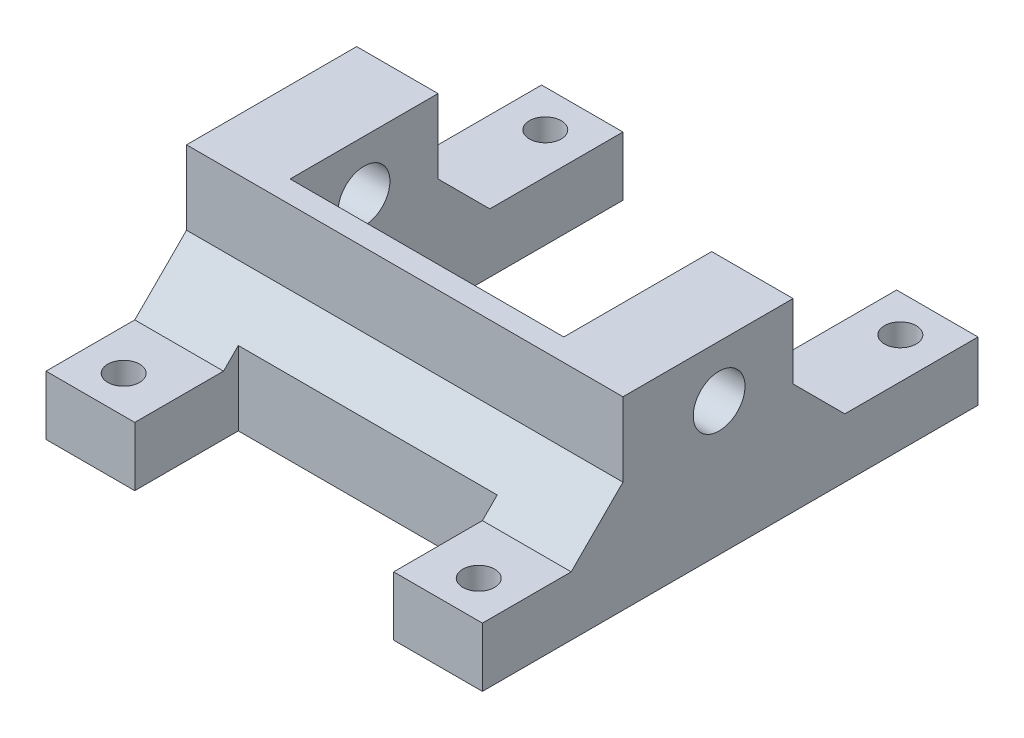
from build123d import *

# Parameters (mm, degrees)
SKETCH_1_R          = 3.5
EXTRUDE_1_DEPTH     = 29.5
SKETCH_3_W          = 37
SKETCH_3_H          = 17
CUT_EXTRUDE_2_DEPTH = 20
CUT_EXTRUDE_3_REACH = 60.849
SKETCH_4_W          = 37
SKETCH_4_H          = 45
SKETCH_4_W_2        = 35
SKETCH_4_H_2        = 14
HOLE_WIZARD_M4_1_D  = 4.3
CHAMFER_1_SIZE      = 7


with BuildPart() as part:
    # 草图1 → 凸台-拉伸1 (new, symmetric)
    with BuildSketch(Plane(origin=(0, 0, 0), x_dir=(0, 0, -1), z_dir=(1, 0, 0))):
        Polygon((0, 8), (0, 25), (23, 25), (23, 8), (48, 8), (48, 0), (-19, 0), (-19, 8), align=None)
        with Locations((13, 18)):
            Circle(SKETCH_1_R, mode=Mode.SUBTRACT)
    extrude(amount=EXTRUDE_1_DEPTH, both=True)

    # 草图3 → 切除-拉伸2 (cut)
    with BuildSketch(Plane(origin=(0, 0, -23), x_dir=(-1, 0, 0), z_dir=(0, 0, -1))):
        with Locations((0, 16.5)):
            Rectangle(SKETCH_3_W, SKETCH_3_H)
    extrude(amount=-CUT_EXTRUDE_2_DEPTH, mode=Mode.SUBTRACT)

    # 草图4 → 切除-拉伸3 (cut, up to next)
    with BuildSketch(Plane(origin=(0, 8, 0), x_dir=(1, 0, 0), z_dir=(0, 1, 0)), mode=Mode.PRIVATE) as cut_extrude_3_sk1:
        with Locations((0, 25.5)):
            Rectangle(SKETCH_4_W, SKETCH_4_H)
    cut_extrude_3_tool1 = extrude(cut_extrude_3_sk1.sketch, amount=-CUT_EXTRUDE_3_REACH, mode=Mode.PRIVATE) & part.part
    # 草图4 → 切除-拉伸3 (cut, up to next)
    with BuildSketch(Plane(origin=(0, 8, 0), x_dir=(1, 0, 0), z_dir=(0, 1, 0)), mode=Mode.PRIVATE) as cut_extrude_3_sk2:
        with Locations((0, -12)):
            Rectangle(SKETCH_4_W_2, SKETCH_4_H_2)
    cut_extrude_3_tool2 = extrude(cut_extrude_3_sk2.sketch, amount=-CUT_EXTRUDE_3_REACH, mode=Mode.PRIVATE) & part.part
    add(cut_extrude_3_tool1.solids().sort_by_distance((0, 8, -25.5))[0], mode=Mode.SUBTRACT)
    add(cut_extrude_3_tool2.solids().sort_by_distance((0, 8, 12))[0], mode=Mode.SUBTRACT)

    # M4 间隙孔1 (through all)
    with Locations(Plane(origin=(0, 0, 0), x_dir=(-1, 0, 0), z_dir=(0, -1, 0))):
        with Locations((24, -14), (24, 43), (-24, -14), (-24, 43)):
            Hole(HOLE_WIZARD_M4_1_D / 2)

    # 倒角1
    # the kernel refuses this chamfer: 7 mm, written as the material it adds along each edge
    with BuildSketch(Plane(origin=(-29.5, 8, 0), x_dir=(0, 0.9996219169112968, -0.027495876610586365), z_dir=(1, 0, 0))) as chamfer_1_piece_1_section:
        Polygon((CHAMFER_1_SIZE * 0.999621916911, CHAMFER_1_SIZE * 0.0274958766106), (-CHAMFER_1_SIZE * 0.0274958766106, CHAMFER_1_SIZE * 0.999621916911), (0, 0), align=None)
    chamfer_1_piece_1 = extrude(amount=59, mode=Mode.PRIVATE)
    chamfer_1_piece_1 = split(chamfer_1_piece_1, bisect_by=Plane(origin=(-17.5, 10.498239804, 1.946316209), z_dir=(-1, 0, 0)), keep=Keep.TOP, mode=Mode.PRIVATE)
    chamfer_1_piece_1 = split(chamfer_1_piece_1, bisect_by=Plane(origin=(-23.5, 10.498239804, 5), z_dir=(0, 0, -1)), keep=Keep.TOP, mode=Mode.PRIVATE)
    add(chamfer_1_piece_1)
    with BuildSketch(Plane(origin=(-29.5, 8, 0), x_dir=(0, 0.9996219169112968, -0.027495876610586365), z_dir=(1, 0, 0))) as chamfer_1_piece_2_section:
        Polygon((CHAMFER_1_SIZE * 0.999621916911, CHAMFER_1_SIZE * 0.0274958766106), (-CHAMFER_1_SIZE * 0.0274958766106, CHAMFER_1_SIZE * 0.999621916911), (0, 0), align=None)
    chamfer_1_piece_2 = extrude(amount=59, mode=Mode.PRIVATE)
    chamfer_1_piece_2 = split(chamfer_1_piece_2, bisect_by=Plane(origin=(-17.5, 8.493423537, 5.774901665), z_dir=(-1, 0, 0)), keep=Keep.TOP, mode=Mode.PRIVATE)
    chamfer_1_piece_2 = split(chamfer_1_piece_2, bisect_by=Plane(origin=(-23.5, 8.493423537, 5), z_dir=(0, 0, 1)), keep=Keep.TOP, mode=Mode.PRIVATE)
    add(chamfer_1_piece_2)
    with BuildSketch(Plane(origin=(-29.5, 8, 0), x_dir=(0, 0.9996219169112968, -0.027495876610586365), z_dir=(1, 0, 0))) as chamfer_1_piece_3_section:
        Polygon((CHAMFER_1_SIZE * 0.999621916911, CHAMFER_1_SIZE * 0.0274958766106), (-CHAMFER_1_SIZE * 0.0274958766106, CHAMFER_1_SIZE * 0.999621916911), (0, 0), align=None)
    chamfer_1_piece_3 = extrude(amount=59, mode=Mode.PRIVATE)
    chamfer_1_piece_3 = split(chamfer_1_piece_3, bisect_by=Plane(origin=(-17.5, 10.498239804, 1.946316209), z_dir=(1, 0, 0)), keep=Keep.TOP, mode=Mode.PRIVATE)
    chamfer_1_piece_3 = split(chamfer_1_piece_3, bisect_by=Plane(origin=(0, 10.498239804, 5), z_dir=(0, 0, -1)), keep=Keep.TOP, mode=Mode.PRIVATE)
    chamfer_1_piece_3 = split(chamfer_1_piece_3, bisect_by=Plane(origin=(17.5, 10.498239804, 1.946316209), z_dir=(-1, 0, 0)), keep=Keep.TOP, mode=Mode.PRIVATE)
    add(chamfer_1_piece_3)
    with BuildSketch(Plane(origin=(-29.5, 8, 0), x_dir=(0, 0.9996219169112968, -0.027495876610586365), z_dir=(1, 0, 0))) as chamfer_1_piece_4_section:
        Polygon((CHAMFER_1_SIZE * 0.999621916911, CHAMFER_1_SIZE * 0.0274958766106), (-CHAMFER_1_SIZE * 0.0274958766106, CHAMFER_1_SIZE * 0.999621916911), (0, 0), align=None)
    chamfer_1_piece_4 = extrude(amount=59, mode=Mode.PRIVATE)
    chamfer_1_piece_4 = split(chamfer_1_piece_4, bisect_by=Plane(origin=(23.5, 10.498239804, 5), z_dir=(0, 0, -1)), keep=Keep.TOP, mode=Mode.PRIVATE)
    chamfer_1_piece_4 = split(chamfer_1_piece_4, bisect_by=Plane(origin=(17.5, 10.498239804, 1.946316209), z_dir=(1, 0, 0)), keep=Keep.TOP, mode=Mode.PRIVATE)
    add(chamfer_1_piece_4)
    with BuildSketch(Plane(origin=(-29.5, 8, 0), x_dir=(0, 0.9996219169112968, -0.027495876610586365), z_dir=(1, 0, 0))) as chamfer_1_piece_5_section:
        Polygon((CHAMFER_1_SIZE * 0.999621916911, CHAMFER_1_SIZE * 0.0274958766106), (-CHAMFER_1_SIZE * 0.0274958766106, CHAMFER_1_SIZE * 0.999621916911), (0, 0), align=None)
    chamfer_1_piece_5 = extrude(amount=59, mode=Mode.PRIVATE)
    chamfer_1_piece_5 = split(chamfer_1_piece_5, bisect_by=Plane(origin=(23.5, 8.493423537, 5), z_dir=(0, 0, 1)), keep=Keep.TOP, mode=Mode.PRIVATE)
    chamfer_1_piece_5 = split(chamfer_1_piece_5, bisect_by=Plane(origin=(17.5, 8.493423537, 5.774901665), z_dir=(1, 0, 0)), keep=Keep.TOP, mode=Mode.PRIVATE)
    add(chamfer_1_piece_5)
    with BuildSketch(Plane(origin=(29.5, 8, -23), x_dir=(0, 0.9996219169112968, 0.02749587661058661), z_dir=(-1, 0, 0)), Plane(origin=(-18.5, 8, -23), x_dir=(0, 0.9996219169112968, 0.02749587661058661), z_dir=(-1, 0, 0))) as chamfer_1_piece_6:
        Polygon((CHAMFER_1_SIZE * 0.999621916911, CHAMFER_1_SIZE * 0.0274958766106), (-CHAMFER_1_SIZE * 0.0274958766106, CHAMFER_1_SIZE * 0.999621916911), (0, 0), align=None)
    extrude(amount=11)


solid = part.part
